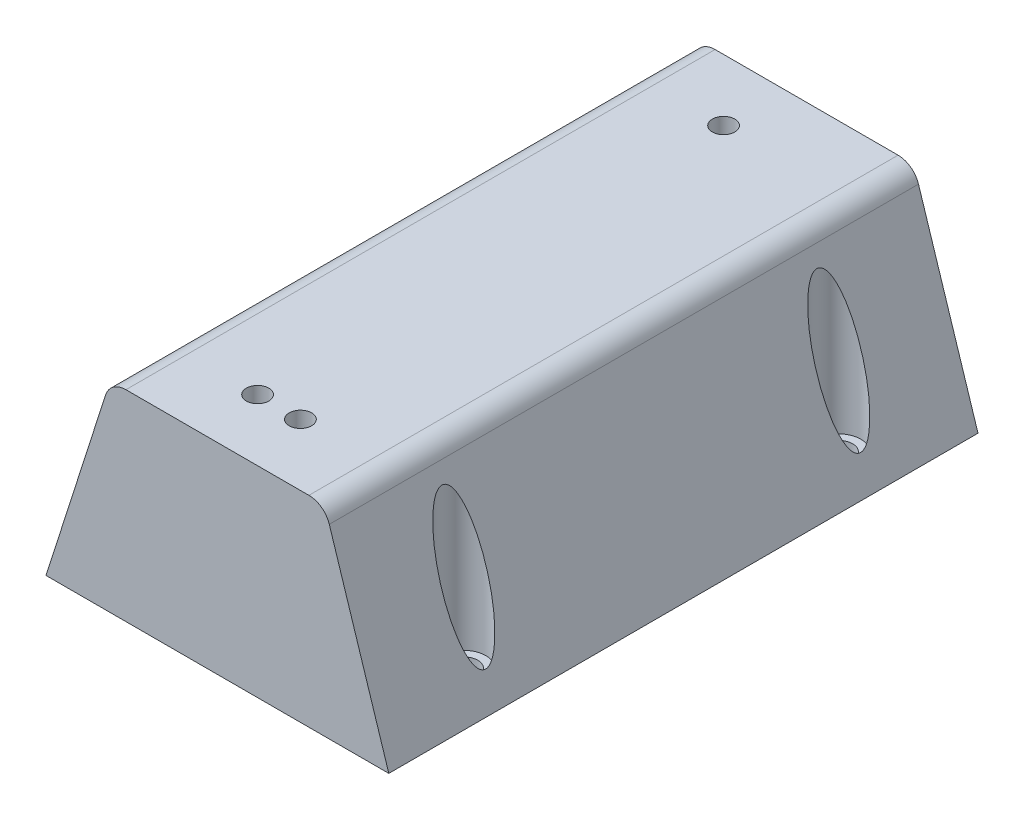
from build123d import *

# Parameters (mm, degrees)
BOSS_EXTRUDE1_DEPTH  = 25
BOSS_EXTRUDE2_DEPTH  = 2.5
SKETCH5_W            = 20
SKETCH5_H            = 7.5
SKETCH5_W_2          = 7.54
SKETCH5_H_2          = 3.54
SKETCH5_W_3          = 3.54
BOSS_EXTRUDE3_DEPTH  = 10
SKETCH6_R            = 1.0485
CUT_EXTRUDE1_DEPTH   = 37.929832114
FILLET1_R            = 2
M2_CLEARANCE_HOLE1_D = 2.6
SKETCH9_R            = 2.05
CUT_EXTRUDE4_DEPTH   = 36.955701912


with BuildPart() as part:
    # Sketch2 → Boss-Extrude1 (new, symmetric)
    with BuildSketch(Plane.XY):
        Polygon((10, -1.25), (10, -17.5), (16, -17.5), (10, 1.25), (-10, 1.25), (-16, -17.5), (-10, -17.5), (-10, -1.25), align=None)
    extrude(amount=BOSS_EXTRUDE1_DEPTH, both=True)

    # Sketch3 → Boss-Extrude2 (add)
    with BuildSketch(Plane.XY.offset(25)):
        Polygon((-10, -17.5), (10, -17.5), (16, -17.5), (10, 1.25), (-10, 1.25), (-16, -17.5), align=None)
    boss_extrude2 = extrude(amount=BOSS_EXTRUDE2_DEPTH)

    # Mirror1: Boss-Extrude2 across plane
    add(boss_extrude2.mirror(Plane.XY))

    # Sketch5 → Boss-Extrude3 (add)
    # profile 1 of 2: a face of its own
    with BuildSketch(Plane.XZ.offset(1.25)):
        with Locations((0, 21.25)):
            Rectangle(SKETCH5_W, SKETCH5_H)
        with Locations((0, 21.75)):
            Rectangle(SKETCH5_W_2, SKETCH5_H_2, mode=Mode.SUBTRACT)
    # profile 2 of 2: a face of its own
    with BuildSketch(Plane.XZ.offset(1.25)):
        with Locations((0, -21.25)):
            Rectangle(SKETCH5_W, SKETCH5_H)
        with Locations((-2, -21.75)):
            Rectangle(SKETCH5_W_3, SKETCH5_H_2, mode=Mode.SUBTRACT)
    extrude(amount=BOSS_EXTRUDE3_DEPTH)

    # Sketch6 → Cut-Extrude1 (cut, through all)
    with BuildSketch(Plane(origin=(0, 1.25, 0), x_dir=(1, 0, 0), z_dir=(0, 1, 0))):
        with Locations((-2, 21.75)):
            Circle(SKETCH6_R)
        with Locations((-2, -21.75)):
            Circle(SKETCH6_R)
        with Locations((2, -21.75)):
            Circle(SKETCH6_R)
    extrude(amount=-CUT_EXTRUDE1_DEPTH, mode=Mode.SUBTRACT)

    # Fillet1
    fillet1_edges = [part.edges().sort_by_distance(p)[0] for p in [
        (10, 1.25, 0),
        (-10, 1.25, 0),
        (0, -11.25, 17.5),
        (0, -11.25, -17.5),
        (-10, -1.25, 0),
        (10, -1.25, 0),
    ]]
    fillet(fillet1_edges, radius=FILLET1_R)

    # M2 Clearance Hole1 (through all)
    with Locations(Plane.XZ.offset(17.5)):
        with Locations((-13, 17.5), (13, 17.5), (13, -17.5), (-13, -17.5)):
            Hole(M2_CLEARANCE_HOLE1_D / 2)

    # Sketch9 → Cut-Extrude4 (cut, through all)
    with BuildSketch(Plane.XZ.offset(15.5)):
        with Locations((-13, -17.5)):
            Circle(SKETCH9_R)
        with Locations((13, -17.5)):
            Circle(SKETCH9_R)
        with Locations((13, 17.5)):
            Circle(SKETCH9_R)
        with Locations((-13, 17.5)):
            Circle(SKETCH9_R)
    extrude(amount=-CUT_EXTRUDE4_DEPTH, mode=Mode.SUBTRACT)


solid = part.part
